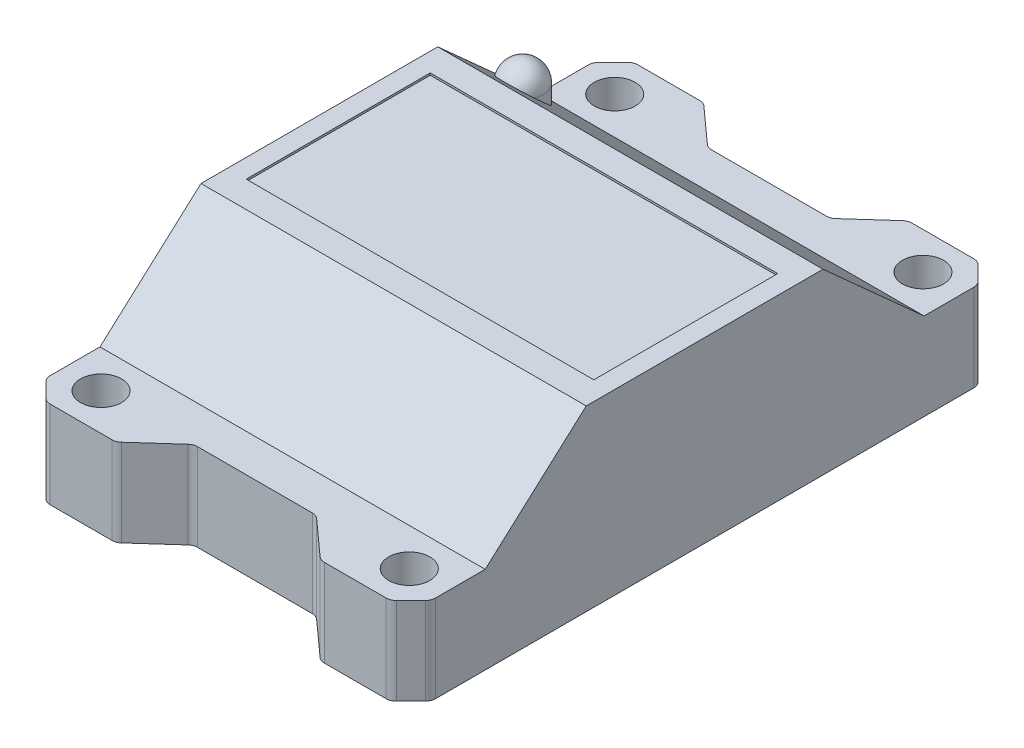
from build123d import *

# Parameters (mm, degrees)
SKETCH1_W               = 47.86122
SKETCH1_H               = 73.00722
SKETCH1_R               = 2.5527
BOSS_EXTRUDE1_DEPTH     = 22.14118
CUT_EXTRUDE1_DEPTH      = 49.943022892
CUT_EXTRUDE1_DEPTH_BACK = 49.943022892
CHAMFER1_SIZE           = 2.54
CUT_EXTRUDE2_DEPTH      = 49.943022892
SKETCH5_W               = 43.18
SKETCH5_H               = 22.86
CUT_EXTRUDE3_DEPTH      = 0.254
SKETCH7_R               = 2.54
BOSS_EXTRUDE3_DEPTH     = 20.32
FILLET1_R               = 2.54
FILLET2_R               = 1.27


with BuildPart() as part:
    # Sketch1 → Boss-Extrude1 (new body)
    with BuildSketch(Plane(origin=(0, 0, 0), x_dir=(1, 0, 0), z_dir=(0, 1, 0))):
        Rectangle(SKETCH1_W, SKETCH1_H)
        with Locations(Location((-19.14525, 31.90875, 0), (0, 0, 270))):
            Circle(SKETCH1_R, mode=Mode.SUBTRACT)
        with Locations(Location((19.14525, 31.90875, 0), (0, 0, 270))):
            Circle(SKETCH1_R, mode=Mode.SUBTRACT)
        with Locations(Location((19.14525, -31.90875, 0), (0, 0, 270))):
            Circle(SKETCH1_R, mode=Mode.SUBTRACT)
        with Locations(Location((-19.14525, -31.90875, 0), (0, 0, 270))):
            Circle(SKETCH1_R, mode=Mode.SUBTRACT)
    extrude(amount=BOSS_EXTRUDE1_DEPTH)

    # Sketch2 → Cut-Extrude1 (cut, two sides: drawn at the far end of the back side and taken through both)
    with BuildSketch(Plane(origin=(0, 0, 0), x_dir=(0, 0, -1), z_dir=(1, 0, 0)).offset(-CUT_EXTRUDE1_DEPTH_BACK)):
        Polygon((14.7066, 22.14118), (-14.7066, 22.14118), (-27.259853255, 10.83818), (-36.50361, 10.83818), (-45.550551374, 42.074053009), (0, 43.630244296), (45.550551374, 42.074053009), (36.50361, 10.83818), (27.259853255, 10.83818), align=None)
    extrude(amount=CUT_EXTRUDE1_DEPTH + CUT_EXTRUDE1_DEPTH_BACK, mode=Mode.SUBTRACT)

    # Chamfer1
    chamfer1_edges = [part.edges().sort_by_distance(p)[0] for p in [
        (-23.93061, 5.41909, -36.50361),
        (23.93061, 5.41909, -36.50361),
        (23.93061, 5.41909, 36.50361),
        (-23.93061, 5.41909, 36.50361),
    ]]
    chamfer(chamfer1_edges, length=CHAMFER1_SIZE)

    # Sketch4 → Cut-Extrude2 (cut, through all)
    with BuildSketch(Plane(origin=(0, 0, 0), x_dir=(1, 0, 0), z_dir=(0, 1, 0))):
        Polygon((-12.7, 36.50361), (-7.62, 31.93161), (7.62, 31.93161), (12.7, 36.50361), align=None)
        Polygon((-12.7, -36.50361), (-7.62, -31.93161), (7.62, -31.93161), (12.7, -36.50361), align=None)
    extrude(amount=CUT_EXTRUDE2_DEPTH, mode=Mode.SUBTRACT)

    # Sketch5 → Cut-Extrude3 (cut)
    with BuildSketch(Plane(origin=(0, 22.14118, 0), x_dir=(1, 0, 0), z_dir=(0, 1, 0))):
        Rectangle(SKETCH5_W, SKETCH5_H)
    extrude(amount=-CUT_EXTRUDE3_DEPTH, mode=Mode.SUBTRACT)

    # Sketch7 → Boss-Extrude3 (add)
    with BuildSketch(Plane(origin=(0, 0, 0), x_dir=(1, 0, 0), z_dir=(0, 1, 0))):
        with Locations(Location((-19.14525, 20.47875, 0), (0, 0, 90))):
            Circle(SKETCH7_R)
    extrude(amount=BOSS_EXTRUDE3_DEPTH)

    # Fillet1
    # the kernel refuses this fillet: 2.54 mm, written as the material it takes off along each edge
    with BuildSketch(Plane(origin=(-19.14525, 20.32, -20.47875), x_dir=(0, 0, -1), z_dir=(1, 0, 0))) as fillet1_piece_1_section:
        with BuildLine():
            CenterArc((2.54 - FILLET1_R, -FILLET1_R), FILLET1_R, 0, 90)
            Line((2.54 - FILLET1_R, 0), (2.54, 0))
            Line((2.54, 0), (2.54, -FILLET1_R))
        make_face()
    fillet1_piece_1 = revolve(axis=Axis((-19.14525, 20.32, -20.47875), (0, 1, 0)), mode=Mode.PRIVATE)
    fillet1_piece_1 = split(fillet1_piece_1, bisect_by=Plane(origin=(-19.14525, 19.033531864, -18.157992912), z_dir=(0, 0.7431448254773929, -0.6691306063588597)), keep=Keep.TOP, mode=Mode.PRIVATE)
    add(fillet1_piece_1, mode=Mode.SUBTRACT)

    # Fillet2
    fillet2_edges = [part.edges().sort_by_distance(p)[0] for p in [
        (-12.7, 5.41909, 36.50361),
        (12.7, 5.41909, 36.50361),
        (7.62, 5.41909, 31.93161),
        (-7.62, 5.41909, 31.93161),
        (-23.93061, 5.41909, 33.96361),
        (-23.93061, 5.41909, -33.96361),
        (21.39061, 5.41909, -36.50361),
        (-21.39061, 5.41909, -36.50361),
        (23.93061, 5.41909, 33.96361),
        (23.93061, 5.41909, -33.96361),
        (21.39061, 5.41909, 36.50361),
        (-21.39061, 5.41909, 36.50361),
        (12.7, 5.41909, -36.50361),
        (-12.7, 5.41909, -36.50361),
        (-7.62, 5.41909, -31.93161),
        (7.62, 5.41909, -31.93161),
    ]]
    fillet(fillet2_edges, radius=FILLET2_R)


solid = part.part
